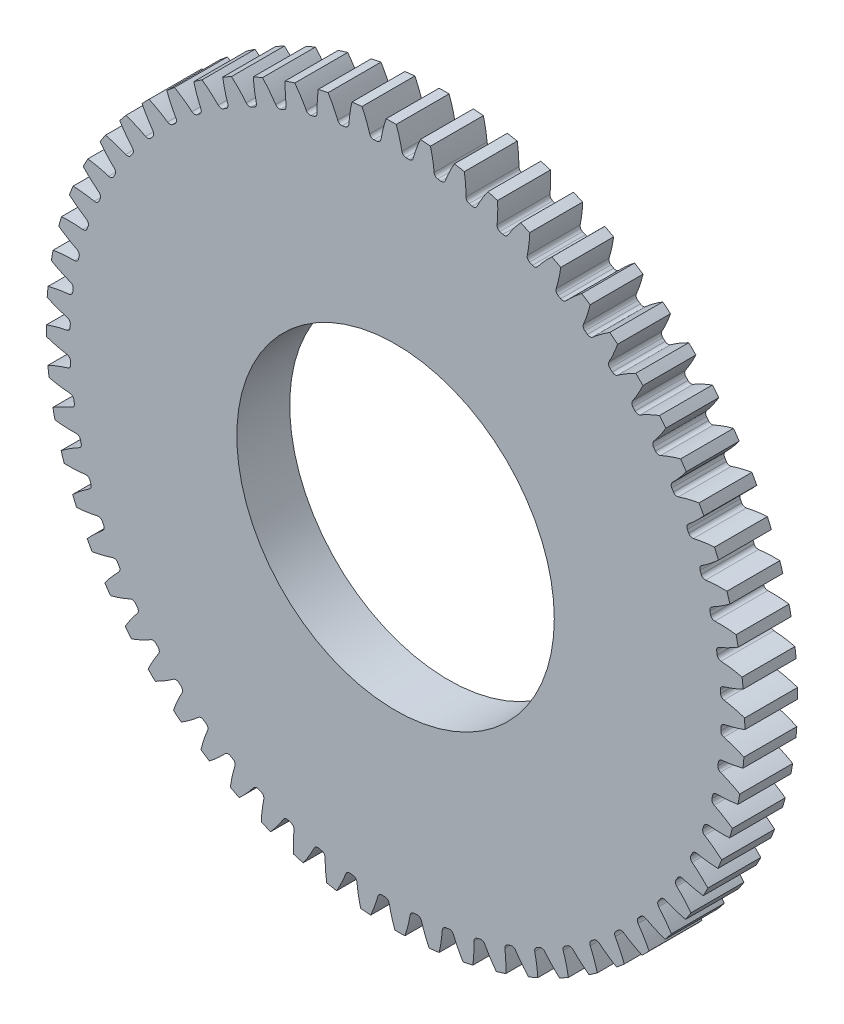
from build123d import *

# Parameters (mm, degrees)
SKETCH3_R         = 41.91
GEARBODY_DEPTH    = 6.35
TOOTHCUT_DEPTH    = 60.60888105
CIRPATTERN1_COUNT = 64
BOREDIA_R         = 19.05
BORE_DEPTH        = 12.7


with BuildPart() as part:
    # Sketch3 → gearBody (new body)
    with BuildSketch(Plane.XY):
        Circle(SKETCH3_R)
    extrude(amount=GEARBODY_DEPTH)

    # Sketch2 → toothCut (cut, through all)
    with BuildSketch(Plane.XY):
        with BuildLine():
            ThreePointArc((39.031726069, -1.616852216), (39.039033465, -1.429586365), (39.045442404, -1.242287613))
            ThreePointArc((39.045442404, -1.242287613), (39.164057208, -0.934854327), (39.448415717, -0.768346262))
            ThreePointArc((39.448415717, -0.768346262), (45.224956892, 1.592886681), (49.672426571, 5.97054158))
            ThreePointArc((49.672426571, 5.97054158), (49.996453383, -1.830840615), (49.102695574, -9.587628256))
            ThreePointArc((49.102695574, -9.587628256), (44.987322783, -4.89640712), (39.398955649, -2.118997942))
            ThreePointArc((39.398955649, -2.118997942), (39.127537281, -1.932137656), (39.031726069, -1.616852216))
        make_face()
    toothcut = extrude(amount=TOOTHCUT_DEPTH, mode=Mode.SUBTRACT)

    # CirPattern1: toothCut ×64 about axis
    cirpattern1_axis = Axis((0, 0, 6.35), (0, 0, -1))
    for i in range(1, CIRPATTERN1_COUNT):
        add(toothcut.rotate(cirpattern1_axis, i * 360 / CIRPATTERN1_COUNT), mode=Mode.SUBTRACT)

    # boreDia → bore (cut, symmetric)
    with BuildSketch(Plane.XY):
        Circle(BOREDIA_R)
    extrude(amount=BORE_DEPTH, both=True, mode=Mode.SUBTRACT)


solid = part.part
